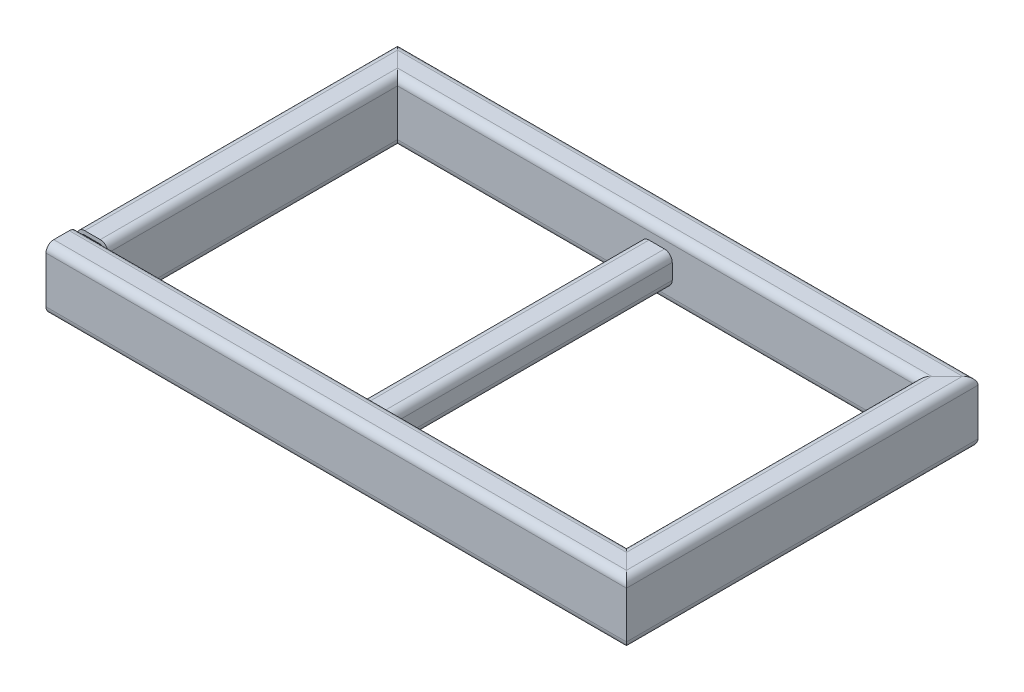
from build123d import *

# Parameters (mm, degrees)
RECTANGULAR_START                          = -287.899978029
RECTANGULAR_TUBE_4_X_2_X_0_25_1_DEPTH      = 525
RECTANGULAR_START_2                        = -132.582521472
RECTANGULAR_TUBE_4_X_2_X_0_25_1_2_OUTLIN_W = 75
RECTANGULAR_TUBE_4_X_2_X_0_25_1_2_OUTLIN_H = 104
RECTANGULAR_TUBE_4_X_2_X_0_25_1_2_DEPTH    = 36.582521472
RECTANGULAR_START_3                        = -475.399978029
RECTANGULAR_TUBE_4_X_2_X_0_25_1_3_DEPTH    = 950.799956058
RECTANGULAR_START_4                        = 132.582521472
RECTANGULAR_TUBE_4_X_2_X_0_25_1_4_OUTLIN_W = 75
RECTANGULAR_TUBE_4_X_2_X_0_25_1_4_OUTLIN_H = 104
RECTANGULAR_TUBE_4_X_2_X_0_25_1_4_DEPTH    = 37.417478528
RECTANGULAR_TUBE_4_X_2_X_0_25_1_5_DEPTH    = 950.799956058
RECTANGULAR_TUBE_4_X_2_X_0_25_1_6_OUTLIN_W = 673.582521472
RECTANGULAR_TUBE_4_X_2_X_0_25_1_6_OUTLIN_H = 104
RECTANGULAR_TUBE_4_X_2_X_0_25_1_6_DEPTH    = 37.417478528
RECTANGULAR_START_5                        = -541
RECTANGULAR_TUBE_4_X_2_X_0_25_1_7_OUTLIN_W = 37.417478528
RECTANGULAR_TUBE_4_X_2_X_0_25_1_7_OUTLIN_H = 104
RECTANGULAR_TUBE_4_X_2_X_0_25_1_7_DEPTH    = 673.582521472
RECTANGULAR_TUBE_4_X_2_X_0_25_1_8_DEPTH    = 575.799956058
RECTANGULAR_START_6                        = 96
RECTANGULAR_TUBE_4_X_2_X_0_25_1_9_OUTLIN_W = 408.417478528
RECTANGULAR_TUBE_4_X_2_X_0_25_1_9_OUTLIN_H = 104
RECTANGULAR_TUBE_4_X_2_X_0_25_1_9_DEPTH    = 36.582521472
RECTANGULAR_TUBE_4_X_2_X_0_25_1_10_OUTLI_W = 37.582521472
RECTANGULAR_TUBE_4_X_2_X_0_25_1_10_OUTLI_H = 104
RECTANGULAR_TUBE_4_X_2_X_0_25_1_10_DEPTH   = 408.417478528
SQUARE_TUBE_2_X_2_X_0_25_1_DEPTH           = 525


with BuildPart() as part:
    # Rectangular tube 4 X 2 X 0.25(1): read off the stored shape, not the designer's step
    # Rectangular tube 4 X 2 X 0.25(1) outline → Rectangular tube 4 X 2 X 0.25(1) (new body)
    with BuildSketch(Plane.XY.offset(RECTANGULAR_START)):
        with BuildLine():
            Line((-475.399978029, 38.1), (-475.399978029, -38.1))
            ThreePointArc((-475.399978029, -38.1), (-471.68023415, -47.080256121), (-462.699978029, -50.8))
            Line((-462.699978029, -50.8), (-437.300021971, -50.8))
            ThreePointArc((-437.300021971, -50.8), (-428.31976585, -47.080256121), (-424.600021971, -38.1))
            Line((-424.600021971, -38.1), (-424.600021971, 38.1))
            ThreePointArc((-424.600021971, 38.1), (-428.31976585, 47.080256121), (-437.300021971, 50.8))
            Line((-437.300021971, 50.8), (-462.699978029, 50.8))
            ThreePointArc((-462.699978029, 50.8), (-471.68023415, 47.080256121), (-475.399978029, 38.1))
        make_face()
        with BuildLine():
            ThreePointArc((-437.300021971, 44.45), (-432.80989391, 42.590128061), (-430.950021971, 38.1))
            Line((-430.950021971, 38.1), (-430.950021971, -38.1))
            ThreePointArc((-430.950021971, -38.1), (-432.80989391, -42.590128061), (-437.300021971, -44.45))
            Line((-437.300021971, -44.45), (-462.699978029, -44.45))
            ThreePointArc((-462.699978029, -44.45), (-467.19010609, -42.590128061), (-469.049978029, -38.1))
            Line((-469.049978029, -38.1), (-469.049978029, 38.1))
            ThreePointArc((-469.049978029, 38.1), (-467.19010609, 42.590128061), (-462.699978029, 44.45))
            Line((-462.699978029, 44.45), (-437.300021971, 44.45))
        make_face(mode=Mode.SUBTRACT)
    extrude(amount=RECTANGULAR_TUBE_4_X_2_X_0_25_1_DEPTH)

    # Rectangular tube 4 X 2 X 0.25_1 2 outlin → Rectangular tube 4 X 2 X 0.25_1 2 (cut)
    with BuildSketch(Plane(origin=(0, 0, 0), x_dir=(0.707106781186548, 0, 0.707106781186547), z_dir=(0.707106781186547, 0, -0.707106781186548)).offset(RECTANGULAR_START_2)):
        with Locations((-503.5, 0)):
            Rectangle(RECTANGULAR_TUBE_4_X_2_X_0_25_1_2_OUTLIN_W, RECTANGULAR_TUBE_4_X_2_X_0_25_1_2_OUTLIN_H)
    extrude(amount=RECTANGULAR_TUBE_4_X_2_X_0_25_1_2_DEPTH, mode=Mode.SUBTRACT)


with BuildPart() as body_2:
    # Rectangular tube 4 X 2 X 0.25_1 3 outlin → Rectangular tube 4 X 2 X 0.25_1 3 (new body)
    with BuildSketch(Plane.YZ.offset(RECTANGULAR_START_3)):
        with BuildLine():
            Line((50.8, 249.800021971), (50.8, 275.199978029))
            ThreePointArc((50.8, 275.199978029), (47.080256121, 284.18023415), (38.1, 287.899978029))
            Line((38.1, 287.899978029), (-38.1, 287.899978029))
            ThreePointArc((-38.1, 287.899978029), (-47.080256121, 284.18023415), (-50.8, 275.199978029))
            Line((-50.8, 275.199978029), (-50.8, 249.800021971))
            ThreePointArc((-50.8, 249.800021971), (-47.080256121, 240.81976585), (-38.1, 237.100021971))
            Line((-38.1, 237.100021971), (38.1, 237.100021971))
            ThreePointArc((38.1, 237.100021971), (47.080256121, 240.81976585), (50.8, 249.800021971))
        make_face()
        with BuildLine():
            ThreePointArc((44.45, 249.800021971), (42.590128061, 245.30989391), (38.1, 243.450021971))
            Line((38.1, 243.450021971), (-38.1, 243.450021971))
            ThreePointArc((-38.1, 243.450021971), (-42.590128061, 245.30989391), (-44.45, 249.800021971))
            Line((-44.45, 249.800021971), (-44.45, 275.199978029))
            ThreePointArc((-44.45, 275.199978029), (-42.590128061, 279.69010609), (-38.1, 281.549978029))
            Line((-38.1, 281.549978029), (38.1, 281.549978029))
            ThreePointArc((38.1, 281.549978029), (42.590128061, 279.69010609), (44.45, 275.199978029))
            Line((44.45, 275.199978029), (44.45, 249.800021971))
        make_face(mode=Mode.SUBTRACT)
    extrude(amount=RECTANGULAR_TUBE_4_X_2_X_0_25_1_3_DEPTH)

    # Rectangular tube 4 X 2 X 0.25_1 4 outlin → Rectangular tube 4 X 2 X 0.25_1 4 (cut)
    with BuildSketch(Plane(origin=(0, 0, 0), x_dir=(0.707106781186548, 0, 0.707106781186547), z_dir=(0.707106781186547, 0, -0.707106781186548)).offset(RECTANGULAR_START_4)):
        with Locations((503.5, 0)):
            Rectangle(RECTANGULAR_TUBE_4_X_2_X_0_25_1_4_OUTLIN_W, RECTANGULAR_TUBE_4_X_2_X_0_25_1_4_OUTLIN_H)
    extrude(amount=RECTANGULAR_TUBE_4_X_2_X_0_25_1_4_DEPTH, mode=Mode.SUBTRACT)


with BuildPart() as body_3:
    # Rectangular tube 4 X 2 X 0.25_1 5 outlin → Rectangular tube 4 X 2 X 0.25_1 5 (new body)
    with BuildSketch(Plane.YZ.offset(RECTANGULAR_START_3)):
        with BuildLine():
            ThreePointArc((38.1, -287.899978029), (47.080256121, -284.18023415), (50.8, -275.199978029))
            Line((50.8, -275.199978029), (50.8, -249.800021971))
            ThreePointArc((50.8, -249.800021971), (47.080256121, -240.81976585), (38.1, -237.100021971))
            Line((38.1, -237.100021971), (-38.1, -237.100021971))
            ThreePointArc((-38.1, -237.100021971), (-47.080256121, -240.81976585), (-50.8, -249.800021971))
            Line((-50.8, -249.800021971), (-50.8, -275.199978029))
            ThreePointArc((-50.8, -275.199978029), (-47.080256121, -284.18023415), (-38.1, -287.899978029))
            Line((-38.1, -287.899978029), (38.1, -287.899978029))
        make_face()
        with BuildLine():
            Line((-38.1, -243.450021971), (38.1, -243.450021971))
            ThreePointArc((38.1, -243.450021971), (42.590128061, -245.30989391), (44.45, -249.800021971))
            Line((44.45, -249.800021971), (44.45, -275.199978029))
            ThreePointArc((44.45, -275.199978029), (42.590128061, -279.69010609), (38.1, -281.549978029))
            Line((38.1, -281.549978029), (-38.1, -281.549978029))
            ThreePointArc((-38.1, -281.549978029), (-42.590128061, -279.69010609), (-44.45, -275.199978029))
            Line((-44.45, -275.199978029), (-44.45, -249.800021971))
            ThreePointArc((-44.45, -249.800021971), (-42.590128061, -245.30989391), (-38.1, -243.450021971))
        make_face(mode=Mode.SUBTRACT)
    extrude(amount=RECTANGULAR_TUBE_4_X_2_X_0_25_1_5_DEPTH)

    # Rectangular tube 4 X 2 X 0.25_1 6 outlin → Rectangular tube 4 X 2 X 0.25_1 6 (cut)
    with BuildSketch(Plane(origin=(0, 0, 0), x_dir=(0.7071067811865471, 0, -0.707106781186548), z_dir=(0.707106781186548, 0, 0.707106781186547)).offset(RECTANGULAR_START_4)):
        with Locations((204.208739264, 0)):
            Rectangle(RECTANGULAR_TUBE_4_X_2_X_0_25_1_6_OUTLIN_W, RECTANGULAR_TUBE_4_X_2_X_0_25_1_6_OUTLIN_H)
    extrude(amount=RECTANGULAR_TUBE_4_X_2_X_0_25_1_6_DEPTH, mode=Mode.SUBTRACT)

    # Rectangular tube 4 X 2 X 0.25_1 7 outlin → Rectangular tube 4 X 2 X 0.25_1 7 (cut)
    with BuildSketch(Plane(origin=(0, 0, 0), x_dir=(0.7071067811865471, 0, -0.707106781186548), z_dir=(0.707106781186548, 0, 0.707106781186547)).offset(RECTANGULAR_START_5)):
        with Locations((-151.291260736, 0)):
            Rectangle(RECTANGULAR_TUBE_4_X_2_X_0_25_1_7_OUTLIN_W, RECTANGULAR_TUBE_4_X_2_X_0_25_1_7_OUTLIN_H)
    extrude(amount=RECTANGULAR_TUBE_4_X_2_X_0_25_1_7_DEPTH, mode=Mode.SUBTRACT)


with BuildPart() as body_4:
    # Rectangular tube 4 X 2 X 0.25_1 8 outlin → Rectangular tube 4 X 2 X 0.25_1 8 (new body)
    with BuildSketch(Plane.XY.offset(RECTANGULAR_START)):
        with BuildLine():
            ThreePointArc((475.399978029, 38.1), (471.68023415, 47.080256121), (462.699978029, 50.8))
            Line((462.699978029, 50.8), (437.300021971, 50.8))
            ThreePointArc((437.300021971, 50.8), (428.31976585, 47.080256121), (424.600021971, 38.1))
            Line((424.600021971, 38.1), (424.600021971, -38.1))
            ThreePointArc((424.600021971, -38.1), (428.31976585, -47.080256121), (437.300021971, -50.8))
            Line((437.300021971, -50.8), (462.699978029, -50.8))
            ThreePointArc((462.699978029, -50.8), (471.68023415, -47.080256121), (475.399978029, -38.1))
            Line((475.399978029, -38.1), (475.399978029, 38.1))
        make_face()
        with BuildLine():
            Line((430.950021971, -38.1), (430.950021971, 38.1))
            ThreePointArc((430.950021971, 38.1), (432.80989391, 42.590128061), (437.300021971, 44.45))
            Line((437.300021971, 44.45), (462.699978029, 44.45))
            ThreePointArc((462.699978029, 44.45), (467.19010609, 42.590128061), (469.049978029, 38.1))
            Line((469.049978029, 38.1), (469.049978029, -38.1))
            ThreePointArc((469.049978029, -38.1), (467.19010609, -42.590128061), (462.699978029, -44.45))
            Line((462.699978029, -44.45), (437.300021971, -44.45))
            ThreePointArc((437.300021971, -44.45), (432.80989391, -42.590128061), (430.950021971, -38.1))
        make_face(mode=Mode.SUBTRACT)
    extrude(amount=RECTANGULAR_TUBE_4_X_2_X_0_25_1_8_DEPTH)

    # Rectangular tube 4 X 2 X 0.25_1 9 outlin → Rectangular tube 4 X 2 X 0.25_1 9 (cut)
    with BuildSketch(Plane(origin=(0, 0, 0), x_dir=(0.707106781186548, 0, 0.707106781186547), z_dir=(0.707106781186547, 0, -0.707106781186548)).offset(RECTANGULAR_START_6)):
        with Locations((336.791260736, 0)):
            Rectangle(RECTANGULAR_TUBE_4_X_2_X_0_25_1_9_OUTLIN_W, RECTANGULAR_TUBE_4_X_2_X_0_25_1_9_OUTLIN_H)
    extrude(amount=RECTANGULAR_TUBE_4_X_2_X_0_25_1_9_DEPTH, mode=Mode.SUBTRACT)

    # Rectangular tube 4 X 2 X 0.25_1 10 outli → Rectangular tube 4 X 2 X 0.25_1 10 (cut)
    with BuildSketch(Plane(origin=(0, 0, 0), x_dir=(0.707106781186548, 0, 0.707106781186547), z_dir=(0.707106781186547, 0, -0.707106781186548)).offset(RECTANGULAR_START_4)):
        with Locations((113.791260736, 0)):
            Rectangle(RECTANGULAR_TUBE_4_X_2_X_0_25_1_10_OUTLI_W, RECTANGULAR_TUBE_4_X_2_X_0_25_1_10_OUTLI_H)
    extrude(amount=RECTANGULAR_TUBE_4_X_2_X_0_25_1_10_DEPTH, mode=Mode.SUBTRACT)


with BuildPart() as body_5:
    # Sketch12 → Square tube 2 X 2 X 0.25(1) (new body)
    with BuildSketch(Plane.XY.offset(-262.5)):
        with BuildLine():
            Line((-12.7, -25.4), (12.7, -25.4))
            ThreePointArc((12.7, -25.4), (21.680256121, -21.680256121), (25.4, -12.7))
            Line((25.4, -12.7), (25.4, 12.7))
            ThreePointArc((25.4, 12.7), (21.680256121, 21.680256121), (12.7, 25.4))
            Line((12.7, 25.4), (-12.7, 25.4))
            ThreePointArc((-12.7, 25.4), (-21.680256121, 21.680256121), (-25.4, 12.7))
            Line((-25.4, 12.7), (-25.4, -12.7))
            ThreePointArc((-25.4, -12.7), (-21.680256121, -21.680256121), (-12.7, -25.4))
        make_face()
        with BuildLine():
            Line((-12.7, -19.05), (12.7, -19.05))
            ThreePointArc((12.7, -19.05), (17.190128061, -17.190128061), (19.05, -12.7))
            Line((19.05, -12.7), (19.05, 12.7))
            ThreePointArc((19.05, 12.7), (17.190128061, 17.190128061), (12.7, 19.05))
            Line((12.7, 19.05), (-12.7, 19.05))
            ThreePointArc((-12.7, 19.05), (-17.190128061, 17.190128061), (-19.05, 12.7))
            Line((-19.05, 12.7), (-19.05, -12.7))
            ThreePointArc((-19.05, -12.7), (-17.190128061, -17.190128061), (-12.7, -19.05))
        make_face(mode=Mode.SUBTRACT)
    extrude(amount=SQUARE_TUBE_2_X_2_X_0_25_1_DEPTH)

    # Trim/Extend1
    split(bisect_by=Plane(origin=(-25.399978029, 0, 237.100021971), x_dir=(0, 1, 0), z_dir=(0, 0, -1)), keep=Keep.TOP)

    # Trim_Extend1 3
    split(bisect_by=Plane(origin=(0, 0, -237.100021971), x_dir=(0, -1, 0), z_dir=(0, 0, 1)), keep=Keep.TOP)


solid = Compound([part.part, body_2.part, body_3.part, body_4.part, body_5.part])
